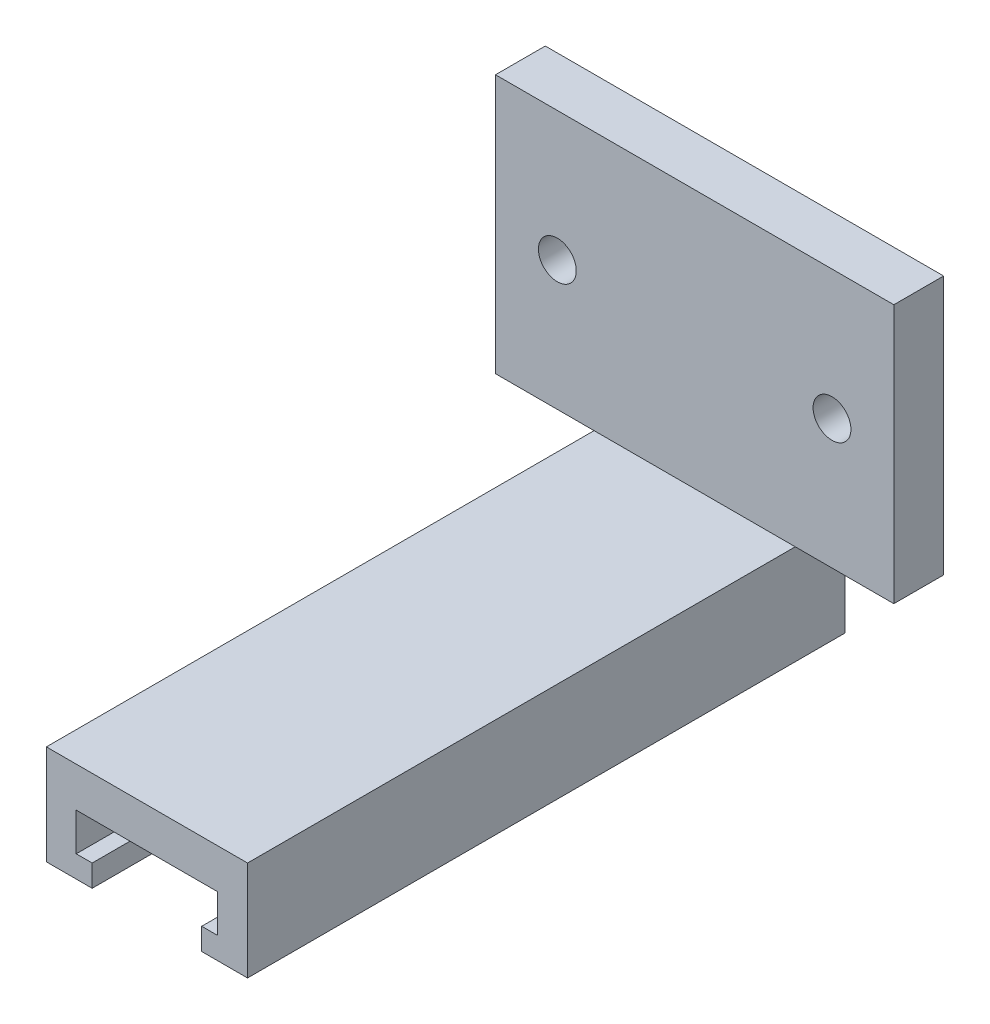
from build123d import *

# Parameters (mm, degrees)
BOSS_EXTRUDE1_DEPTH = 38.1
BOSS_EXTRUDE2_DEPTH = 1.27
SKETCH3_W           = 50.8
SKETCH3_H           = 33.02
SKETCH3_R           = 2.413
BOSS_EXTRUDE3_DEPTH = 6.35


with BuildPart() as part:
    # Sketch1 → Boss-Extrude1 (new, symmetric)
    with BuildSketch(Plane.XY):
        Polygon((-12.827, 0), (12.827, 0), (12.827, -12.7), (6.985, -12.7), (6.985, -9.906), (9.017, -9.906), (9.017, -5.08), (-9.017, -5.08), (-9.017, -9.906), (-6.985, -9.906), (-6.985, -12.7), (-12.827, -12.7), align=None)
    extrude(amount=BOSS_EXTRUDE1_DEPTH, both=True)

    # Sketch2 → Boss-Extrude2 (add, symmetric)
    with BuildSketch(Plane(origin=(0, 0, 0), x_dir=(0, 0, -1), z_dir=(1, 0, 0))):
        Polygon((6.858, -5.08), (9.398, -8.89), (11.938, -5.08), align=None)
    extrude(amount=BOSS_EXTRUDE2_DEPTH, both=True)

    # Sketch3 → Boss-Extrude3 (add)
    with BuildSketch(Plane(origin=(0, 0, -38.1), x_dir=(-1, 0, 0), z_dir=(0, 0, -1))):
        with Locations((0, 16.51)):
            Rectangle(SKETCH3_W, SKETCH3_H)
        with Locations((17.5133, 16.51)):
            Circle(SKETCH3_R, mode=Mode.SUBTRACT)
        with Locations((-17.5133, 16.51)):
            Circle(SKETCH3_R, mode=Mode.SUBTRACT)
    extrude(amount=-BOSS_EXTRUDE3_DEPTH)


solid = part.part
